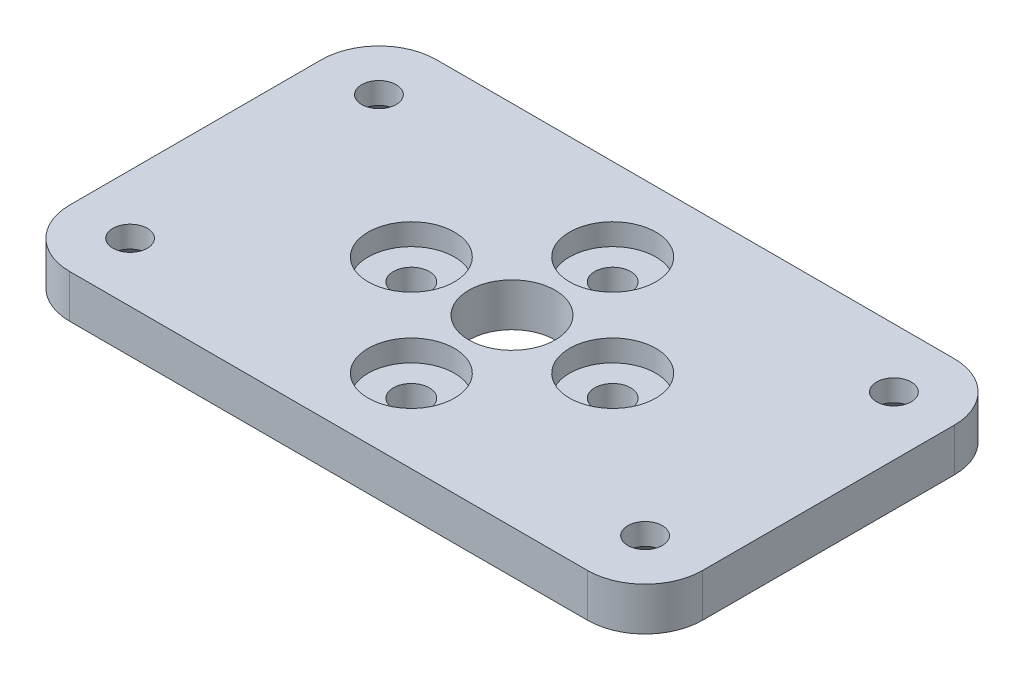
from build123d import *

# Parameters (mm, degrees)
SKETCH_1_W          = 44
SKETCH_1_H          = 25.5
SKETCH_1_R          = 1.25
SKETCH_1_R_2        = 1.2
SKETCH_1_R_3        = 3
EXTRUDE_1_DEPTH     = 3
FILLET_1_R          = 4
SKETCH_2_R          = 3
CUT_EXTRUDE_1_DEPTH = 1.5
CHAMFER_1_SIZE      = 1.5


with BuildPart() as part:
    # 草图1 → 凸台-拉伸1 (new body)
    with BuildSketch(Plane(origin=(0, 0, 0), x_dir=(1, 0, 0), z_dir=(0, 1, 0))):
        Rectangle(SKETCH_1_W, SKETCH_1_H)
        with Locations((7, 0)):
            Circle(SKETCH_1_R, mode=Mode.SUBTRACT)
        with Locations((0, -7)):
            Circle(SKETCH_1_R, mode=Mode.SUBTRACT)
        with Locations((-7, 0)):
            Circle(SKETCH_1_R, mode=Mode.SUBTRACT)
        with Locations((0, 7)):
            Circle(SKETCH_1_R, mode=Mode.SUBTRACT)
        with Locations((-17.9, 8.65)):
            Circle(SKETCH_1_R_2, mode=Mode.SUBTRACT)
        with Locations((17.9, 8.65)):
            Circle(SKETCH_1_R_2, mode=Mode.SUBTRACT)
        with Locations((-17.9, -8.65)):
            Circle(SKETCH_1_R_2, mode=Mode.SUBTRACT)
        with Locations((17.9, -8.65)):
            Circle(SKETCH_1_R_2, mode=Mode.SUBTRACT)
        Circle(SKETCH_1_R_3, mode=Mode.SUBTRACT)
    extrude(amount=EXTRUDE_1_DEPTH)

    # 圆角1
    fillet_1_edges = [part.edges().sort_by_distance(p)[0] for p in [
        (-22, 1.5, -12.75),
        (-22, 1.5, 12.75),
        (22, 1.5, 12.75),
        (22, 1.5, -12.75),
    ]]
    fillet(fillet_1_edges, radius=FILLET_1_R)

    # 草图2 → 切除-拉伸1 (cut)
    with BuildSketch(Plane(origin=(0, 3, 0), x_dir=(1, 0, 0), z_dir=(0, 1, 0))):
        with Locations((7, 0)):
            Circle(SKETCH_2_R)
        with Locations((0, -7)):
            Circle(SKETCH_2_R)
        with Locations((-7, 0)):
            Circle(SKETCH_2_R)
        with Locations((0, 7)):
            Circle(SKETCH_2_R)
    extrude(amount=-CUT_EXTRUDE_1_DEPTH, mode=Mode.SUBTRACT)

    # 倒角1
    chamfer_1_edges = [part.edges().sort_by_distance(p)[0] for p in [
        (16.7, 0, -8.65),
        (16.7, 0, 8.65),
        (-19.1, 0, 8.65),
        (-19.1, 0, -8.65),
    ]]
    chamfer(chamfer_1_edges, length=CHAMFER_1_SIZE)


solid = part.part
